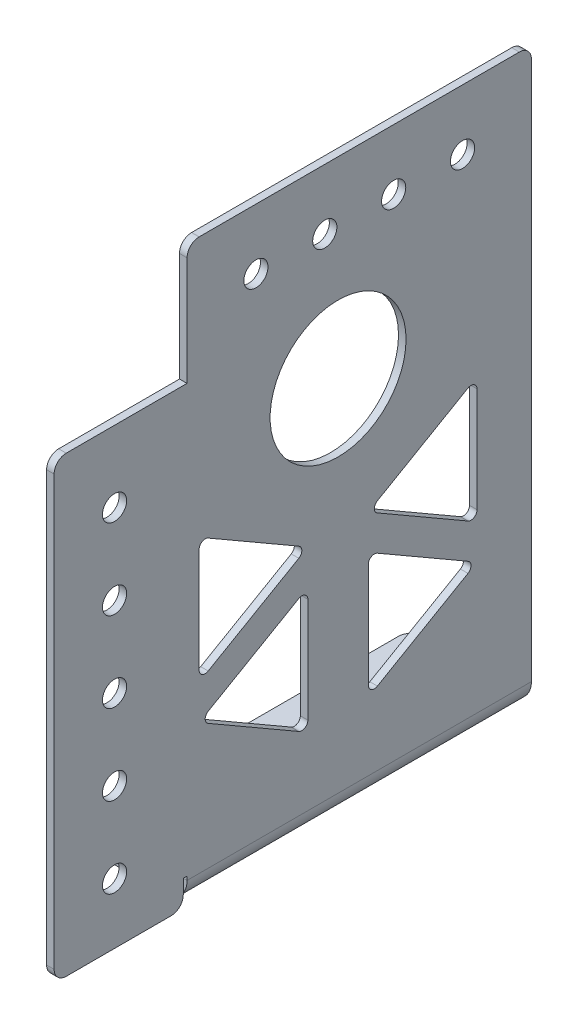
from build123d import *

# Parameters (mm, degrees)
SKETCH2_R                     = 14.2875
SKETCH2_R_2                   = 2.54
BOSS_EXTRUDE1_DEPTH           = 1.5875
SKETCH7_W                     = 1.5875
SKETCH7_H                     = 27.94
CUT_EXTRUDE1_DEPTH            = 0.00254
EDGE_FLANGE2_STRIP_W          = 12.7
EDGE_FLANGE2_STRIP_H          = 1.5875
EDGE_FLANGE2_STRIP_CUT_DEPTH  = 72.39
EDGE_FLANGE2_RELIEF_W         = 13.49375
EDGE_FLANGE2_RELIEF_H         = 0.79375
EDGE_FLANGE2_RELIEF_CUT_DEPTH = 1.5875
EDGE_FLANGE2_DEPTH            = 72.39
SKETCH14_R                    = 2.54
CUT_EXTRUDE2_DEPTH            = 1.5875
FILLET1_R                     = 2.54


# Sheet-metal steps are written as plain solids
with BuildPart() as part:
    # Sketch2 → Boss-Extrude1 (new body)
    with BuildSketch(Plane(origin=(0, 0, 0), x_dir=(0, 0, -1), z_dir=(1, 0, 0))):
        Polygon((-59.69, 95.25), (-59.69, 0), (40.64, 0), (40.64, 95.25), (40.64, 120.65), (-31.75, 120.65), (-31.75, 95.25), align=None)
        with Locations((0, 80.264)):
            Circle(SKETCH2_R, mode=Mode.SUBTRACT)
        with Locations((-46.99, 80.264)):
            Circle(SKETCH2_R_2, mode=Mode.SUBTRACT)
        with Locations((-46.99, 63.373)):
            Circle(SKETCH2_R_2, mode=Mode.SUBTRACT)
        with Locations((-17.272, 107.95)):
            Circle(SKETCH2_R_2, mode=Mode.SUBTRACT)
        with Locations((-2.794, 107.95)):
            Circle(SKETCH2_R_2, mode=Mode.SUBTRACT)
        with Locations((11.684, 107.95)):
            Circle(SKETCH2_R_2, mode=Mode.SUBTRACT)
        with Locations((26.162, 107.95)):
            Circle(SKETCH2_R_2, mode=Mode.SUBTRACT)
        with Locations((-46.99, 46.482)):
            Circle(SKETCH2_R_2, mode=Mode.SUBTRACT)
        with Locations((-46.99, 29.591)):
            Circle(SKETCH2_R_2, mode=Mode.SUBTRACT)
        with Locations((-46.99, 12.7)):
            Circle(SKETCH2_R_2, mode=Mode.SUBTRACT)
        with BuildLine():
            Line((-27.305, 64.866068321), (-8.255, 53.867545693))
            ThreePointArc((-8.255, 53.867545693), (-7.62, 52.76769343), (-8.255, 51.667841167))
            Line((-8.255, 51.667841167), (-27.305, 40.669318539))
            ThreePointArc((-27.305, 40.669318539), (-28.575, 40.669318539), (-29.21, 41.769170802))
            Line((-29.21, 41.769170802), (-29.21, 63.766216058))
            ThreePointArc((-29.21, 63.766216058), (-28.575, 64.866068321), (-27.305, 64.866068321))
        make_face(mode=Mode.SUBTRACT)
        with BuildLine():
            Line((-6.35, 43.235640486), (-6.35, 21.238595229))
            ThreePointArc((-6.35, 21.238595229), (-6.985, 20.138742967), (-8.255, 20.138742967))
            Line((-8.255, 20.138742967), (-27.305, 31.137265595))
            ThreePointArc((-27.305, 31.137265595), (-27.94, 32.237117857), (-27.305, 33.33697012))
            Line((-27.305, 33.33697012), (-8.255, 44.335492748))
            ThreePointArc((-8.255, 44.335492748), (-6.985, 44.335492748), (-6.35, 43.235640486))
        make_face(mode=Mode.SUBTRACT)
        with BuildLine():
            Line((8.255, 20.138742967), (27.305, 31.137265595))
            ThreePointArc((27.305, 31.137265595), (27.94, 32.237117857), (27.305, 33.33697012))
            Line((27.305, 33.33697012), (8.255, 44.335492748))
            ThreePointArc((8.255, 44.335492748), (6.985, 44.335492748), (6.35, 43.235640486))
            Line((6.35, 43.235640486), (6.35, 21.238595229))
            ThreePointArc((6.35, 21.238595229), (6.985, 20.138742967), (8.255, 20.138742967))
        make_face(mode=Mode.SUBTRACT)
        with BuildLine():
            Line((8.255, 51.667841167), (27.305, 40.669318539))
            ThreePointArc((27.305, 40.669318539), (28.575, 40.669318539), (29.21, 41.769170802))
            Line((29.21, 41.769170802), (29.21, 63.766216058))
            ThreePointArc((29.21, 63.766216058), (28.575, 64.866068321), (27.305, 64.866068321))
            Line((27.305, 64.866068321), (8.255, 53.867545693))
            ThreePointArc((8.255, 53.867545693), (7.62, 52.76769343), (8.255, 51.667841167))
        make_face(mode=Mode.SUBTRACT)
    extrude(amount=BOSS_EXTRUDE1_DEPTH)

    # Sketch7 → Cut-Extrude1 (cut)
    with BuildSketch(Plane(origin=(0, 0, 0), x_dir=(-1, 0, 0), z_dir=(0, -1, 0))):
        with Locations((-0.79375, -45.72)):
            Rectangle(SKETCH7_W, SKETCH7_H)
    extrude(amount=-CUT_EXTRUDE1_DEPTH, mode=Mode.SUBTRACT)

    # Edge-Flange2 strip (across the edge) → Edge-Flange2 strip cut (cut)
    with BuildSketch(Plane(origin=(0, 0, -40.64), x_dir=(0, 1, 0), z_dir=(0, 0, 1))):
        with Locations((-1.5875, -0.79375)):
            Rectangle(EDGE_FLANGE2_STRIP_W, EDGE_FLANGE2_STRIP_H)
    extrude(amount=EDGE_FLANGE2_STRIP_CUT_DEPTH, mode=Mode.SUBTRACT)

    # Edge-Flange2 relief (on the sheet) → Edge-Flange2 relief cut (cut)
    with BuildSketch(Plane(origin=(0, 4.7625, -40.64), x_dir=(0, 1, 0), z_dir=(-1, 0, 0))):
        with Locations((-5.953125, -72.786875)):
            Rectangle(EDGE_FLANGE2_RELIEF_W, EDGE_FLANGE2_RELIEF_H)
    extrude(amount=-EDGE_FLANGE2_RELIEF_CUT_DEPTH, mode=Mode.SUBTRACT)

    # Edge-Flange2 section (across the edge) → Edge-Flange2 (add)
    with BuildSketch(Plane(origin=(0, 0, -40.64), x_dir=(0, 1, 0), z_dir=(0, 0, 1))):
        with BuildLine():
            Line((0, 3.175), (0, 23.8125))
            Line((0, 23.8125), (1.5875, 23.8125))
            Line((1.5875, 23.8125), (1.5875, 3.175))
            ThreePointArc((1.5875, 3.175), (2.51743597, 0.92993597), (4.7625, 0))
            Line((4.7625, 0), (4.7625, -1.5875))
            ThreePointArc((4.7625, -1.5875), (1.394903955, -0.192596045), (0, 3.175))
        make_face()
    extrude(amount=EDGE_FLANGE2_DEPTH)

    # Sketch14 → Cut-Extrude2 (cut)
    with BuildSketch(Plane(origin=(0, 1.5875, 0), x_dir=(1, 0, 0), z_dir=(0, 1, 0))):
        with Locations(Location((-13.49375, 28.575, 0), (0, 0, 180))):
            Circle(SKETCH14_R)
        with Locations(Location((-13.49375, 16.51, 0), (0, 0, 180))):
            Circle(SKETCH14_R)
        with Locations(Location((-13.49375, 4.445, 0), (0, 0, 180))):
            Circle(SKETCH14_R)
        with Locations(Location((-13.49375, -7.62, 0), (0, 0, 180))):
            Circle(SKETCH14_R)
        with Locations(Location((-13.49375, -19.685, 0), (0, 0, 180))):
            Circle(SKETCH14_R)
    extrude(amount=-CUT_EXTRUDE2_DEPTH, mode=Mode.SUBTRACT)

    # Fillet1
    fillet1_edges = [part.edges().sort_by_distance(p)[0] for p in [
        (0.79375, 0.00254, 32.54375),
        (-23.8125, 0.79375, -40.64),
        (-23.8125, 0.79375, 31.75),
        (0.79375, 120.65, -40.64),
        (0.79375, 95.25, 59.69),
        (0.79375, 120.65, 31.75),
        (0.79375, 0.00254, 59.69),
    ]]
    fillet(fillet1_edges, radius=FILLET1_R)


solid = part.part
